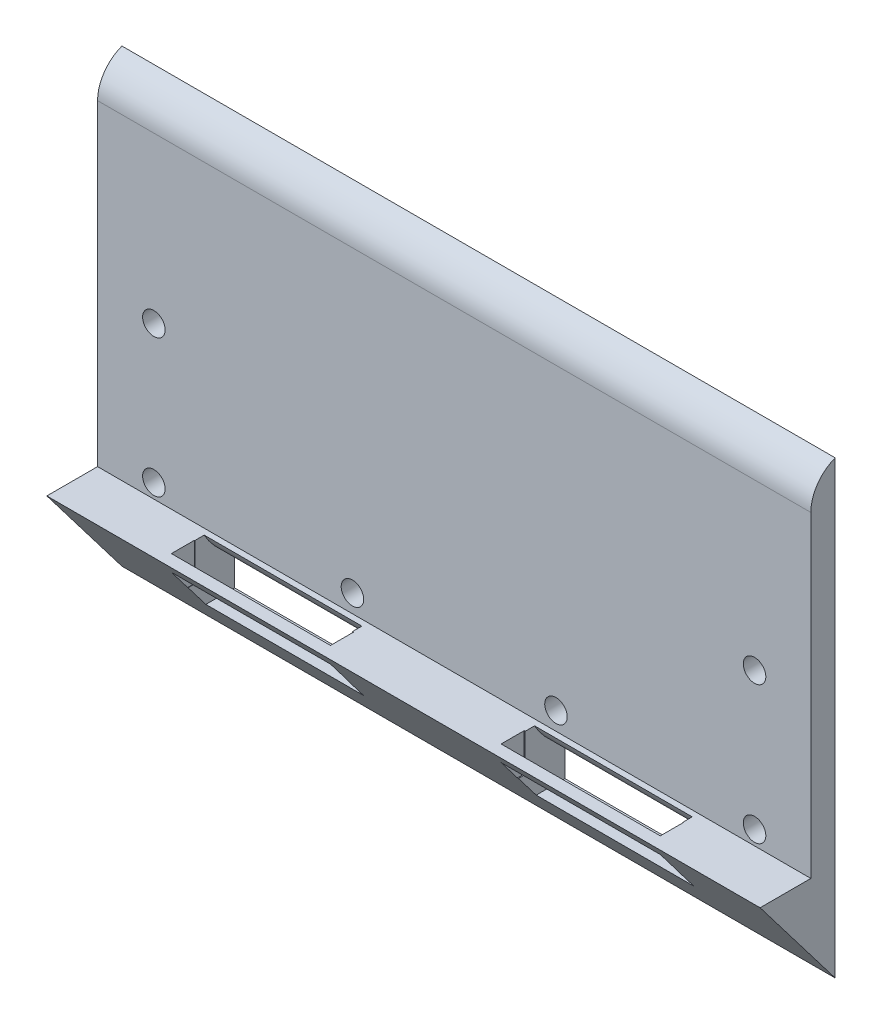
from build123d import *

# Parameters (mm, degrees)
CROQUIS1_W              = 95
CROQUIS1_H              = 50
SALIENTE_EXTRUIR1_DEPTH = 10
CROQUIS2_W              = 21
CROQUIS2_H              = 4.123726598
CORTAR_EXTRUIR1_DEPTH   = 20
CORTAR_EXTRUIR2_DEPTH   = 1000
REDONDEO1_R             = 5
CROQUIS5_R              = 1.5
CORTAR_EXTRUIR3_DEPTH   = 10
CORTAR_EXTRUIR4_DEPTH   = 140
CROQUIS8_W              = 21.19141069
CROQUIS8_H              = 3.071218941
CROQUIS8_W_2            = 21.2
CORTAR_EXTRUIR5_DEPTH   = 5
REDONDEO2_R             = 10
REDONDEO3_R             = 10
CROQUIS9_W              = 95
CROQUIS9_H              = 3.240818253
SALIENTE_EXTRUIR2_DEPTH = 10
REDONDEO4_R             = 5


with BuildPart() as part:
    # Croquis1 → Saliente-Extruir1 (new body)
    with BuildSketch(Plane.XY):
        with Locations((0.195712782, 7.120478413)):
            Rectangle(CROQUIS1_W, CROQUIS1_H)
    extrude(amount=SALIENTE_EXTRUIR1_DEPTH)

    # Croquis2 → Cortar-Extruir1 (cut)
    with BuildSketch(Plane.XY.offset(10)):
        with Locations((-21.804287218, -10.817658288)):
            Rectangle(CROQUIS2_W, CROQUIS2_H)
        with Locations((22.195712782, -10.817658288)):
            Rectangle(CROQUIS2_W, CROQUIS2_H)
    extrude(amount=-CORTAR_EXTRUIR1_DEPTH, mode=Mode.SUBTRACT)

    # Croquis3 → Cortar-Extruir2 (cut)
    with BuildSketch(Plane.ZY.offset(47.304287218)):
        Polygon((0, -17.879521587), (10, -4.774745355), (10, -17.879521587), align=None)
    extrude(amount=-CORTAR_EXTRUIR2_DEPTH, mode=Mode.SUBTRACT)

    # Redondeo1
    redondeo1_edges = [part.edges().sort_by_distance(p)[0] for p in [
        (0.195712782, 32.120478413, 10),
    ]]
    fillet(redondeo1_edges, radius=REDONDEO1_R)

    # Croquis5 → Cortar-Extruir3 (cut)
    with BuildSketch(Plane.XY.offset(10)):
        with Locations((-39.804287218, 15.480478413)):
            Circle(CROQUIS5_R)
        with Locations(Location((40.195712782, 15.480478413, 0), (0, 0, 180))):
            Circle(CROQUIS5_R)
        with Locations((-13.357848867, -2.379521587)):
            Circle(CROQUIS5_R)
        with Locations(Location((13.749274431, -2.379521587, 0), (0, 0, 180))):
            Circle(CROQUIS5_R)
        with Locations((-39.804287218, -2.859521587)):
            Circle(CROQUIS5_R)
        with Locations(Location((40.195712782, -2.859521587, 0), (0, 0, 180))):
            Circle(CROQUIS5_R)
    extrude(amount=-CORTAR_EXTRUIR3_DEPTH, mode=Mode.SUBTRACT)

    # Croquis7 → Cortar-Extruir4 (cut)
    with BuildSketch(Plane.ZY.offset(47.304287218)):
        Polygon((10, -4.774745355), (4.790814809, -4.774745355), (3.240818253, -4.774745355), (3.240818253, -4.292734616), (3.240818253, 32.120478413), (5, 32.120478413), (10, 32.120478413), align=None)
    extrude(amount=-CORTAR_EXTRUIR4_DEPTH, mode=Mode.SUBTRACT)

    # Croquis8 → Cortar-Extruir5 (cut)
    with BuildSketch(Plane(origin=(0, -4.774745355, 0), x_dir=(1, 0, 0), z_dir=(0, 1, 0))):
        with Locations((-21.763502643, -6.820936578)):
            Rectangle(CROQUIS8_W, CROQUIS8_H)
        with Locations((22.159222862, -6.820936578)):
            Rectangle(CROQUIS8_W_2, CROQUIS8_H)
    extrude(amount=-CORTAR_EXTRUIR5_DEPTH, mode=Mode.SUBTRACT)

    # Redondeo2
    # the kernel refuses this fillet: 10 mm, written as the material it takes off along each edge
    with BuildSketch(Plane(origin=(-11.304287218, -8.755794989, 5.285327107), x_dir=(0, 0, -1), z_dir=(-1, 0, 0))) as redondeo2_piece_1:
        with BuildLine():
            CenterArc((10, -8.818835496), REDONDEO2_R, 118.129583681, 61.870416319)
            Line((0, -8.818835496), (-0.2, -8.818835496))
            Line((-0.2, -8.818835496), (-0.2, 0))
            Line((-0.2, 0), (0, 0.2))
            ThreePointArc((0, 0.2), (2.642663554, 0.2), (5.191033649, 0.17637671))
            Line((5.191033649, 0.17637671), (5.285327107, 0))
        make_face()
    extrude(amount=21, mode=Mode.SUBTRACT)

    # Redondeo3
    # the kernel refuses this fillet: 10 mm, written as the material it takes off along each edge
    with BuildSketch(Plane(origin=(11.695712782, -8.755794989, 5.285327107), x_dir=(0, 0, -1), z_dir=(1, 0, 0))) as redondeo3_piece_1:
        with BuildLine():
            CenterArc((10, 8.818835496), REDONDEO3_R, 180, 61.870416319)
            Line((0, 8.818835496), (-0.2, 8.818835496))
            Line((-0.2, 8.818835496), (-0.2, 0))
            Line((-0.2, 0), (0, -0.2))
            ThreePointArc((0, -0.2), (2.642663554, -0.2), (5.191033649, -0.17637671))
            Line((5.191033649, -0.17637671), (5.285327107, 0))
        make_face()
    extrude(amount=21, mode=Mode.SUBTRACT)

    # Croquis9 → Saliente-Extruir2 (add)
    with BuildSketch(Plane(origin=(0, 32.120478413, 0), x_dir=(1, 0, 0), z_dir=(0, 1, 0))):
        with Locations((0.195712782, -1.620409127)):
            Rectangle(CROQUIS9_W, CROQUIS9_H)
    extrude(amount=SALIENTE_EXTRUIR2_DEPTH)

    # Redondeo4
    # the kernel refuses this fillet: 5 mm, written as the material it takes off along each edge
    with BuildSketch(Plane(origin=(59.396481876, 42.120478413, 3.240818253), x_dir=(0, 0, -1), z_dir=(-1, 0, 0))) as redondeo4_piece_1:
        with BuildLine():
            CenterArc((5, 4.680307637), REDONDEO4_R, 180, 69.400324349)
            Line((0, 4.680307637), (-0.1, 4.680307637))
            Line((-0.1, 4.680307637), (-0.1, 0))
            Line((-0.1, 0), (0, -0.1))
            ThreePointArc((0, -0.1), (1.620409126, -0.1), (3.205634618, -0.093606153))
            Line((3.205634618, -0.093606153), (3.240818253, 0))
        make_face()
    extrude(amount=118.401538187, mode=Mode.SUBTRACT)


solid = part.part
